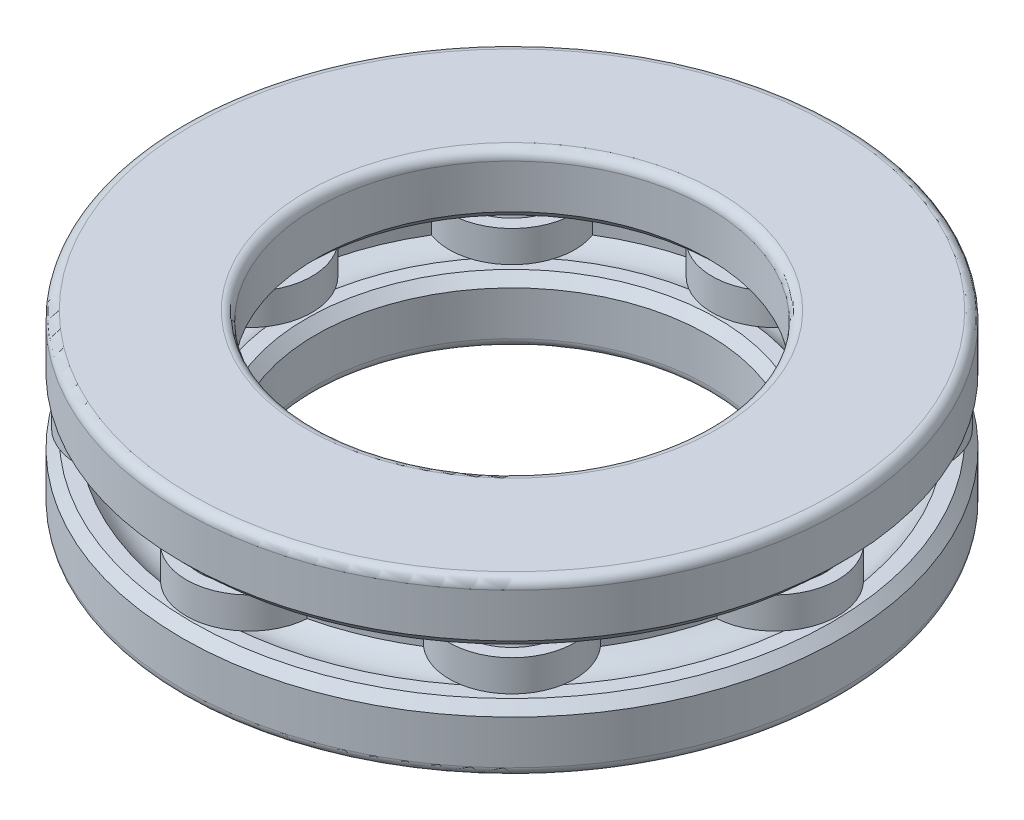
from build123d import *

# Parameters (mm, degrees)
CIRPATTERN2_COUNT        = 8
FILLET1_R                = 0.6
CHAMFER1_SIZE            = 0.6
FILLET2_R                = 0.6
CHAMFER2_SIZE            = 0.6
BOSS_EXTRUDE1_DEPTH      = 1
BOSS_EXTRUDE1_DEPTH_BACK = 1
SKETCH4_R                = 3.2


with BuildPart() as part:
    # Sketch1 → Revolve4 (revolve)
    with BuildSketch(Plane(origin=(0, 0, 0), x_dir=(0, 0, -1), z_dir=(1, 0, 0))):
        with BuildLine():
            Line((-16.75, 3), (-16.75, -3))
            ThreePointArc((-16.75, -3), (-19.75, 0), (-16.75, 3))
        make_face()
    revolve(axis=Axis((0, 0, 16.75), (0, 1, 0)))


with BuildPart() as body_2:
    # Sketch3 → Revolve5 (revolve)
    with BuildSketch(Plane(origin=(0, 0, 0), x_dir=(0, 0, -1), z_dir=(1, 0, 0))):
        with BuildLine():
            Line((-12.5, 5.5), (-21, 5.5))
            Line((-21, 5.5), (-21, 1.5))
            Line((-21, 1.5), (-19.462931993, 1.5))
            ThreePointArc((-19.462931993, 1.5), (-16.75, 3.1), (-14.037068007, 1.5))
            Line((-14.037068007, 1.5), (-12.5, 1.5))
            Line((-12.5, 1.5), (-12.5, 5.5))
        make_face()
        with BuildLine():
            ThreePointArc((-14.037068007, -1.5), (-16.75, -3.1), (-19.462931993, -1.5))
            Line((-19.462931993, -1.5), (-21, -1.5))
            Line((-21, -1.5), (-21, -5.5))
            Line((-21, -5.5), (-12.5, -5.5))
            Line((-12.5, -5.5), (-12.5, -1.5))
            Line((-12.5, -1.5), (-14.037068007, -1.5))
        make_face()
    revolve(axis=Axis((0, 0, 0), (0, 1, 0)))

    # Fillet1
    fillet1_edges = [body_2.edges().sort_by_distance(p)[0] for p in [
        (0, 5.5, -12.5),
        (0, 5.5, -21),
    ]]
    fillet(fillet1_edges, radius=FILLET1_R)

    # Chamfer1
    chamfer1_edges = [body_2.edges().sort_by_distance(p)[0] for p in [
        (0, -1.5, -12.5),
        (0, -1.5, -21),
    ]]
    chamfer(chamfer1_edges, length=CHAMFER1_SIZE)

    # Fillet2
    fillet2_edges = [body_2.edges().sort_by_distance(p)[0] for p in [
        (0, -5.5, -12.5),
        (0, -5.5, -21),
    ]]
    fillet(fillet2_edges, radius=FILLET2_R)

    # Chamfer2
    chamfer2_edges = [body_2.edges().sort_by_distance(p)[0] for p in [
        (0, 1.5, -12.5),
        (0, 1.5, -21),
    ]]
    chamfer(chamfer2_edges, length=CHAMFER2_SIZE)


with BuildPart() as cirpattern2_1:
    # CirPattern2: pattern copy
    add(part.part.rotate(Axis((0, 5.5, 0), (0, -1, 0)), 1 * 360 / CIRPATTERN2_COUNT))


with BuildPart() as cirpattern2_2:
    # CirPattern2: pattern copy
    add(part.part.rotate(Axis((0, 5.5, 0), (0, -1, 0)), 2 * 360 / CIRPATTERN2_COUNT))


with BuildPart() as cirpattern2_3:
    # CirPattern2: pattern copy
    add(part.part.rotate(Axis((0, 5.5, 0), (0, -1, 0)), 3 * 360 / CIRPATTERN2_COUNT))


with BuildPart() as cirpattern2_4:
    # CirPattern2: pattern copy
    add(part.part.rotate(Axis((0, 5.5, 0), (0, -1, 0)), 4 * 360 / CIRPATTERN2_COUNT))


with BuildPart() as cirpattern2_5:
    # CirPattern2: pattern copy
    add(part.part.rotate(Axis((0, 5.5, 0), (0, -1, 0)), 5 * 360 / CIRPATTERN2_COUNT))


with BuildPart() as cirpattern2_6:
    # CirPattern2: pattern copy
    add(part.part.rotate(Axis((0, 5.5, 0), (0, -1, 0)), 6 * 360 / CIRPATTERN2_COUNT))


with BuildPart() as cirpattern2_7:
    # CirPattern2: pattern copy
    add(part.part.rotate(Axis((0, 5.5, 0), (0, -1, 0)), 7 * 360 / CIRPATTERN2_COUNT))


with BuildPart() as body_10:
    # Sketch4 → Boss-Extrude1 (new, two sides: drawn at the far end of the back side and taken through both)
    with BuildSketch(Plane(origin=(0, 0, 0), x_dir=(1, 0, 0), z_dir=(0, 1, 0)).offset(-BOSS_EXTRUDE1_DEPTH_BACK)):
        with BuildLine():
            ThreePointArc((-17.039179104, -3.989533237), (-16.167891819, -6.696960066), (-14.869545096, -9.227493085))
            ThreePointArc((-14.869545096, -9.227493085), (-14.67246571, -14.67246571), (-9.227493085, -14.869545096))
            ThreePointArc((-9.227493085, -14.869545096), (-6.696960066, -16.167891819), (-3.989533237, -17.039179104))
            ThreePointArc((-3.989533237, -17.039179104), (0, -20.75), (3.989533237, -17.039179104))
            ThreePointArc((3.989533237, -17.039179104), (6.696960066, -16.167891819), (9.227493085, -14.869545096))
            ThreePointArc((9.227493085, -14.869545096), (14.67246571, -14.67246571), (14.869545096, -9.227493085))
            ThreePointArc((14.869545096, -9.227493085), (16.167891819, -6.696960066), (17.039179104, -3.989533237))
            ThreePointArc((17.039179104, -3.989533237), (20.75, 0), (17.039179104, 3.989533237))
            ThreePointArc((17.039179104, 3.989533237), (16.167891819, 6.696960066), (14.869545096, 9.227493085))
            ThreePointArc((14.869545096, 9.227493085), (14.67246571, 14.67246571), (9.227493085, 14.869545096))
            ThreePointArc((9.227493085, 14.869545096), (6.696960066, 16.167891819), (3.989533237, 17.039179104))
            ThreePointArc((3.989533237, 17.039179104), (0, 20.75), (-3.989533237, 17.039179104))
            ThreePointArc((-3.989533237, 17.039179104), (-6.696960066, 16.167891819), (-9.227493085, 14.869545096))
            ThreePointArc((-9.227493085, 14.869545096), (-14.67246571, 14.67246571), (-14.869545096, 9.227493085))
            ThreePointArc((-14.869545096, 9.227493085), (-16.167891819, 6.696960066), (-17.039179104, 3.989533237))
            ThreePointArc((-17.039179104, 3.989533237), (-20.75, 0), (-17.039179104, -3.989533237))
        make_face()
        with BuildLine():
            ThreePointArc((-15.069029851, -3.629647277), (-12.75, 0), (-15.069029851, 3.629647277))
            ThreePointArc((-15.069029851, 3.629647277), (-14.320132754, 5.931593202), (-13.221961396, 8.08886499))
            ThreePointArc((-13.221961396, 8.08886499), (-9.01561146, 9.01561146), (-8.08886499, 13.221961396))
            ThreePointArc((-8.08886499, 13.221961396), (-5.931593202, 14.320132754), (-3.629647277, 15.069029851))
            ThreePointArc((-3.629647277, 15.069029851), (0, 12.75), (3.629647277, 15.069029851))
            ThreePointArc((3.629647277, 15.069029851), (5.931593202, 14.320132754), (8.08886499, 13.221961396))
            ThreePointArc((8.08886499, 13.221961396), (9.01561146, 9.01561146), (13.221961396, 8.08886499))
            ThreePointArc((13.221961396, 8.08886499), (14.320132754, 5.931593202), (15.069029851, 3.629647277))
            ThreePointArc((15.069029851, 3.629647277), (12.75, 0), (15.069029851, -3.629647277))
            ThreePointArc((15.069029851, -3.629647277), (14.320132754, -5.931593202), (13.221961396, -8.08886499))
            ThreePointArc((13.221961396, -8.08886499), (9.01561146, -9.01561146), (8.08886499, -13.221961396))
            ThreePointArc((8.08886499, -13.221961396), (5.931593202, -14.320132754), (3.629647277, -15.069029851))
            ThreePointArc((3.629647277, -15.069029851), (0, -12.75), (-3.629647277, -15.069029851))
            ThreePointArc((-3.629647277, -15.069029851), (-5.931593202, -14.320132754), (-8.08886499, -13.221961396))
            ThreePointArc((-8.08886499, -13.221961396), (-9.01561146, -9.01561146), (-13.221961396, -8.08886499))
            ThreePointArc((-13.221961396, -8.08886499), (-14.320132754, -5.931593202), (-15.069029851, -3.629647277))
        make_face(mode=Mode.SUBTRACT)
        with Locations((-16.75, 0)):
            Circle(SKETCH4_R, mode=Mode.SUBTRACT)
        with Locations((-11.844038585, -11.844038585)):
            Circle(SKETCH4_R, mode=Mode.SUBTRACT)
        with Locations((-11.844038585, 11.844038585)):
            Circle(SKETCH4_R, mode=Mode.SUBTRACT)
        with Locations((0, -16.75)):
            Circle(SKETCH4_R, mode=Mode.SUBTRACT)
        with Locations((0, 16.75)):
            Circle(SKETCH4_R, mode=Mode.SUBTRACT)
        with Locations((11.844038585, -11.844038585)):
            Circle(SKETCH4_R, mode=Mode.SUBTRACT)
        with Locations((11.844038585, 11.844038585)):
            Circle(SKETCH4_R, mode=Mode.SUBTRACT)
        with Locations((16.75, 0)):
            Circle(SKETCH4_R, mode=Mode.SUBTRACT)
    extrude(amount=BOSS_EXTRUDE1_DEPTH + BOSS_EXTRUDE1_DEPTH_BACK)


solid = Compound([part.part, body_2.part, cirpattern2_1.part, cirpattern2_2.part, cirpattern2_3.part, cirpattern2_4.part, cirpattern2_5.part, cirpattern2_6.part, cirpattern2_7.part, body_10.part])
